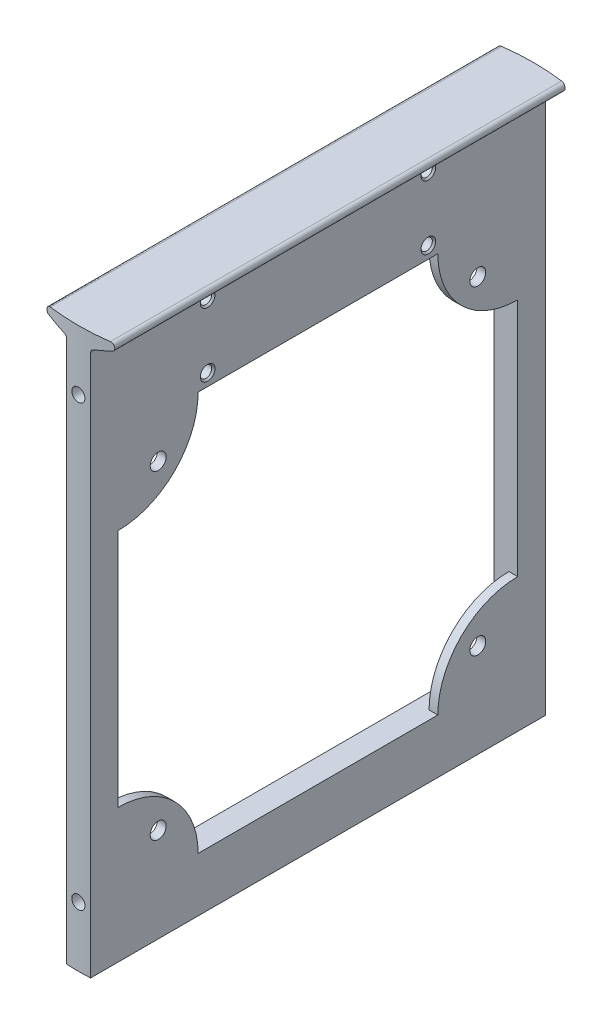
from build123d import *
from build123d.topology import SkipClean

# Parameters (mm, degrees)
BOSS_EXTRUDE1_DEPTH                  = 70
M4_TAPPED_HOLE1_D                    = 3.3
M4_TAPPED_HOLE1_DEPTH                = 11.5
M4_TAPPED_HOLE1_TIP                  = 0.991420021
M4_TAPPED_HOLE1_ON_FACE_2_D          = 3.3
M4_TAPPED_HOLE1_ON_FACE_2_DEPTH      = 11.5
M4_TAPPED_HOLE1_ON_FACE_2_TIP        = 0.991420021
BOSS_EXTRUDE3_REACH                  = 92.322
BOSS_EXTRUDE3_END_RADIUS             = 57
BOSS_EXTRUDE3_DIRECTION_2_REACH      = 92.322
BOSS_EXTRUDE3_DIRECTION_2_END_RADIUS = 57
CUT_EXTRUDE4_DEPTH                   = 91.671109116
CUT_EXTRUDE4_DEPTH_BACK              = 91.671109116
SKETCH5_W                            = 100
SKETCH5_H                            = 100
FILLET1_START                        = -3
FILLET1_DEPTH                        = 6
BOSS_EXTRUDE4_START                  = 0.8
SKETCH6_R                            = 2
BOSS_EXTRUDE4_DEPTH                  = 2.2
SKETCH12_R                           = 1.84
CUT_EXTRUDE6_DEPTH                   = 2.58


with BuildPart() as part:
    # Sketch1 → Boss-Extrude1 (new, symmetric)
    with BuildSketch(Plane(origin=(0, 0, 0), x_dir=(1, 0, 0), z_dir=(0, 1, 0))):
        with BuildLine():
            Line((-3, 56.920997883), (-3, -56.920997883))
            ThreePointArc((-3, -56.920997883), (0, -57), (3, -56.920997883))
            Line((3, -56.920997883), (3, 56.920997883))
            ThreePointArc((3, 56.920997883), (0, 57), (-3, 56.920997883))
        make_face()
    extrude(amount=BOSS_EXTRUDE1_DEPTH, both=True)

    # M4 Tapped Hole1
    with Locations(Plane(origin=(0, 55, 57), x_dir=(1, 0, 0), z_dir=(0, 0, 1))):
        with Locations((0, 0), (0, -110)):
            Hole(M4_TAPPED_HOLE1_D / 2, depth=M4_TAPPED_HOLE1_DEPTH)
            with Locations((0, 0, -(M4_TAPPED_HOLE1_DEPTH + M4_TAPPED_HOLE1_TIP / 2))):  # 118° drill point
                Cone(0, M4_TAPPED_HOLE1_D / 2, M4_TAPPED_HOLE1_TIP, mode=Mode.SUBTRACT)

    # M4 Tapped Hole1 on face 2
    with Locations(Plane(origin=(0, 55, -57), x_dir=(-1, 0, 0), z_dir=(0, 0, -1))):
        with Locations((0, 0), (0, -110)):
            Hole(M4_TAPPED_HOLE1_ON_FACE_2_D / 2, depth=M4_TAPPED_HOLE1_ON_FACE_2_DEPTH)
            with Locations((0, 0, -(M4_TAPPED_HOLE1_ON_FACE_2_DEPTH + M4_TAPPED_HOLE1_ON_FACE_2_TIP / 2))):  # 118° drill point
                Cone(0, M4_TAPPED_HOLE1_ON_FACE_2_D / 2, M4_TAPPED_HOLE1_ON_FACE_2_TIP, mode=Mode.SUBTRACT)

    # Boss-Extrude3: up to this cylinder (the profile starts inside it)
    with SkipClean():  # the faces are left unmerged after this step: merging them gives an invalid solid
        boss_extrude3_end = Plane(origin=(0, 67.695148, 0), z_dir=(0, -1, 0)) * Cylinder(BOSS_EXTRUDE3_END_RADIUS, 299.644, mode=Mode.PRIVATE)
        # Sketch4 → Boss-Extrude3 (add, up to the surface)
        with BuildSketch(Plane.XY, mode=Mode.PRIVATE) as boss_extrude3_sk1:
            with BuildLine():
                Line((-7.5, 70), (7.5, 70))
                ThreePointArc((7.5, 70), (8.48399318, 69.178206122), (7.850707217, 68.063514844))
                Line((7.850707217, 68.063514844), (3.649292783, 66.490114182))
                ThreePointArc((3.649292783, 66.490114182), (3.178200993, 66.123406518), (3, 65.553629026))
                Line((3, 65.553629026), (3, 64))
                Line((3, 64), (-3, 64))
                Line((-3, 64), (-3, 65.553629026))
                ThreePointArc((-3, 65.553629026), (-3.178200993, 66.123406518), (-3.649292783, 66.490114182))
                Line((-3.649292783, 66.490114182), (-7.850707217, 68.063514844))
                ThreePointArc((-7.850707217, 68.063514844), (-8.48399318, 69.178206122), (-7.5, 70))
            make_face()
        boss_extrude3_tool1 = extrude(boss_extrude3_sk1.sketch, amount=BOSS_EXTRUDE3_REACH, mode=Mode.PRIVATE) & boss_extrude3_end
        add(boss_extrude3_tool1.solids().sort_by_distance((0, 67.695148, 0))[0])

    # Boss-Extrude3 direction 2: up to this cylinder (the profile starts inside it)
    with SkipClean():  # the faces are left unmerged after this step: merging them gives an invalid solid
        boss_extrude3_direction_2_end = Plane(origin=(0, 67.695148, 0), z_dir=(0, -1, 0)) * Cylinder(BOSS_EXTRUDE3_DIRECTION_2_END_RADIUS, 299.644, mode=Mode.PRIVATE)
        # Sketch4 → Boss-Extrude3 direction 2 (add, up to the surface)
        with BuildSketch(Plane.XY, mode=Mode.PRIVATE) as boss_extrude3_direction_2_sk1:
            with BuildLine():
                Line((-7.5, 70), (7.5, 70))
                ThreePointArc((7.5, 70), (8.48399318, 69.178206122), (7.850707217, 68.063514844))
                Line((7.850707217, 68.063514844), (3.649292783, 66.490114182))
                ThreePointArc((3.649292783, 66.490114182), (3.178200993, 66.123406518), (3, 65.553629026))
                Line((3, 65.553629026), (3, 64))
                Line((3, 64), (-3, 64))
                Line((-3, 64), (-3, 65.553629026))
                ThreePointArc((-3, 65.553629026), (-3.178200993, 66.123406518), (-3.649292783, 66.490114182))
                Line((-3.649292783, 66.490114182), (-7.850707217, 68.063514844))
                ThreePointArc((-7.850707217, 68.063514844), (-8.48399318, 69.178206122), (-7.5, 70))
            make_face()
        boss_extrude3_direction_2_tool1 = extrude(boss_extrude3_direction_2_sk1.sketch, amount=-BOSS_EXTRUDE3_DIRECTION_2_REACH, mode=Mode.PRIVATE) & boss_extrude3_direction_2_end
        add(boss_extrude3_direction_2_tool1.solids().sort_by_distance((0, 67.695148, 0))[0])

    # Sketch5 → Cut-Extrude4 (cut, two sides: drawn at the far end of the back side and taken through both)
    with SkipClean():  # the faces are left unmerged after this step: merging them gives an invalid solid
        with BuildSketch(Plane(origin=(0, 0, 0), x_dir=(0, 0, -1), z_dir=(1, 0, 0)).offset(-CUT_EXTRUDE4_DEPTH_BACK)):
            with Locations((0, -6.446370974)):
                Rectangle(SKETCH5_W, SKETCH5_H)
        extrude(amount=CUT_EXTRUDE4_DEPTH + CUT_EXTRUDE4_DEPTH_BACK, mode=Mode.SUBTRACT)

    # Fillet1: read off the stored shape, not the designer's step
    # Fillet1 outline → Fillet1 (add)
    with SkipClean():  # the faces are left unmerged after this step: merging them gives an invalid solid
        with BuildSketch(Plane.YZ.offset(FILLET1_START)):
            with BuildLine():
                ThreePointArc((43.553629026, -40), (40.624696838, -47.071067812), (33.553629026, -50))
                Line((33.553629026, -50), (43.553629026, -50))
                Line((43.553629026, -50), (43.553629026, -40))
            make_face()
            with BuildLine():
                Line((-56.446370974, -50), (-46.446370974, -50))
                ThreePointArc((-46.446370974, -50), (-53.517438786, -47.071067812), (-56.446370974, -40))
                Line((-56.446370974, -40), (-56.446370974, -50))
            make_face()
            with BuildLine():
                ThreePointArc((33.553629026, 50), (40.624696838, 47.071067812), (43.553629026, 40))
                Line((43.553629026, 40), (43.553629026, 50))
                Line((43.553629026, 50), (33.553629026, 50))
            make_face()
            with BuildLine():
                Line((-56.446370974, 50), (-56.446370974, 40))
                ThreePointArc((-56.446370974, 40), (-53.517438786, 47.071067812), (-46.446370974, 50))
                Line((-46.446370974, 50), (-56.446370974, 50))
            make_face()
        extrude(amount=FILLET1_DEPTH)

    # Fillet1 2 outline → Fillet1 2 (revolve, cut)
    with SkipClean():  # the faces are left unmerged after this step: merging them gives an invalid solid
        with BuildSketch(Plane.XZ.offset(55)):
            Polygon((1.65, -50), (1.65, -45.5), (0.283508406, -44.678929015), (0, -44.678929015), (0, -50), align=None)
            Polygon((1.65, 50), (0, 50), (0, 44.678929015), (0.283508406, 44.678929015), (1.65, 45.5), align=None)
        revolve(axis=Axis((0, -55, 0), (0, 0, 1)), mode=Mode.SUBTRACT)

    # Sketch6 → Boss-Extrude4 (add)
    # profile 1 of 4: a face of its own
    with SkipClean():  # the faces are left unmerged after this step: merging them gives an invalid solid
        with BuildSketch(Plane(origin=(0, 0, 0), x_dir=(0, 0, -1), z_dir=(1, 0, 0)).offset(BOSS_EXTRUDE4_START)):
            with BuildLine():
                Line((50, 43.553629026), (50, 23.553629026))
                ThreePointArc((50, 23.553629026), (35.857864376, 29.411493402), (30, 43.553629026))
                Line((30, 43.553629026), (50, 43.553629026))
            make_face()
            with Locations(Location((40, 33.553629026, 0), (0, 0, 180))):
                Circle(SKETCH6_R, mode=Mode.SUBTRACT)
        # profile 2 of 4: a face of its own
        with BuildSketch(Plane(origin=(0, 0, 0), x_dir=(0, 0, -1), z_dir=(1, 0, 0)).offset(BOSS_EXTRUDE4_START)):
            with BuildLine():
                Line((-50, 43.553629026), (-30, 43.553629026))
                ThreePointArc((-30, 43.553629026), (-35.857864376, 29.411493402), (-50, 23.553629026))
                Line((-50, 23.553629026), (-50, 43.553629026))
            make_face()
            with Locations(Location((-40, 33.553629026, 0), (0, 0, 180))):
                Circle(SKETCH6_R, mode=Mode.SUBTRACT)
        # profile 3 of 4: a face of its own
        with BuildSketch(Plane(origin=(0, 0, 0), x_dir=(0, 0, -1), z_dir=(1, 0, 0)).offset(BOSS_EXTRUDE4_START)):
            with BuildLine():
                Line((-50, -56.446370974), (-50, -36.446370974))
                ThreePointArc((-50, -36.446370974), (-35.857864376, -42.304235351), (-30, -56.446370974))
                Line((-30, -56.446370974), (-50, -56.446370974))
            make_face()
            with Locations(Location((-40, -46.446370974, 0), (0, 0, 180))):
                Circle(SKETCH6_R, mode=Mode.SUBTRACT)
        # profile 4 of 4: a face of its own
        with BuildSketch(Plane(origin=(0, 0, 0), x_dir=(0, 0, -1), z_dir=(1, 0, 0)).offset(BOSS_EXTRUDE4_START)):
            with BuildLine():
                Line((50, -56.446370974), (30, -56.446370974))
                ThreePointArc((30, -56.446370974), (35.857864376, -42.304235351), (50, -36.446370974))
                Line((50, -36.446370974), (50, -56.446370974))
            make_face()
            with Locations(Location((40, -46.446370974, 0), (0, 0, 180))):
                Circle(SKETCH6_R, mode=Mode.SUBTRACT)
        extrude(amount=BOSS_EXTRUDE4_DEPTH)

    # Hole1: read off the stored shape, not the designer's step
    # Hole1 outline → Hole1 (revolve, cut)
    with SkipClean():  # the faces are left unmerged after this step: merging them gives an invalid solid
        with BuildSketch(Plane(origin=(0, 46.553629026, -27.6225), x_dir=(0, 1, 0), z_dir=(0, 0, -1))):
            Polygon((0, -3), (1.42, -3), (1.42, 2.58), (1.84, 3), (0, 3), align=None)
        hole1 = revolve(axis=Axis((0, 46.553629026, -27.6225), (1, 0, 0)), mode=Mode.SUBTRACT)

    # Hole1 2 outline → Hole1 2 (revolve, cut)
    with SkipClean():  # the faces are left unmerged after this step: merging them gives an invalid solid
        with BuildSketch(Plane(origin=(0, 62.553629026, 27.6225), x_dir=(0, 1, 0), z_dir=(0, 0, -1))):
            Polygon((0, -3), (1.42, -3), (1.42, 2.58), (1.84, 3), (0, 3), align=None)
        hole1_2 = revolve(axis=Axis((0, 62.553629026, 27.6225), (1, 0, 0)), mode=Mode.SUBTRACT)

    # Hole1 3 outline → Hole1 3 (revolve, cut)
    with SkipClean():  # the faces are left unmerged after this step: merging them gives an invalid solid
        with BuildSketch(Plane(origin=(0, 46.553629026, 27.6225), x_dir=(0, 1, 0), z_dir=(0, 0, -1))):
            Polygon((0, -3), (1.42, -3), (1.42, 2.58), (1.84, 3), (0, 3), align=None)
        hole1_3 = revolve(axis=Axis((0, 46.553629026, 27.6225), (1, 0, 0)), mode=Mode.SUBTRACT)

    # Hole1 4 outline → Hole1 4 (revolve, cut)
    with SkipClean():  # the faces are left unmerged after this step: merging them gives an invalid solid
        with BuildSketch(Plane(origin=(0, 62.553629026, -27.6225), x_dir=(0, 1, 0), z_dir=(0, 0, -1))):
            Polygon((0, -3), (1.42, -3), (1.42, 2.58), (1.84, 3), (0, 3), align=None)
        hole1_4 = revolve(axis=Axis((0, 62.553629026, -27.6225), (1, 0, 0)), mode=Mode.SUBTRACT)

    # Mirror1: Hole1, Hole1 2, Hole1 3, Hole1 4 across plane
    with SkipClean():  # the faces are left unmerged after this step: merging them gives an invalid solid
        add(hole1.mirror(Plane(origin=(0, 0, 0), x_dir=(0, 0, 1), z_dir=(1, 0, 0))), mode=Mode.SUBTRACT)
        add(hole1_2.mirror(Plane(origin=(0, 0, 0), x_dir=(0, 0, 1), z_dir=(1, 0, 0))), mode=Mode.SUBTRACT)
        add(hole1_3.mirror(Plane(origin=(0, 0, 0), x_dir=(0, 0, 1), z_dir=(1, 0, 0))), mode=Mode.SUBTRACT)
        add(hole1_4.mirror(Plane(origin=(0, 0, 0), x_dir=(0, 0, 1), z_dir=(1, 0, 0))), mode=Mode.SUBTRACT)

    # Sketch12 → Cut-Extrude6 (cut, symmetric)
    with SkipClean():  # the faces are left unmerged after this step: merging them gives an invalid solid
        with BuildSketch(Plane(origin=(0, 0, 0), x_dir=(0, 0, -1), z_dir=(1, 0, 0))):
            with Locations((-27.6225, 62.553629026)):
                Circle(SKETCH12_R)
            with Locations((-27.6225, 46.553629026)):
                Circle(SKETCH12_R)
            with Locations((27.6225, 62.553629026)):
                Circle(SKETCH12_R)
            with Locations((27.6225, 46.553629026)):
                Circle(SKETCH12_R)
        extrude(amount=CUT_EXTRUDE6_DEPTH, both=True, mode=Mode.SUBTRACT)


solid = part.part
